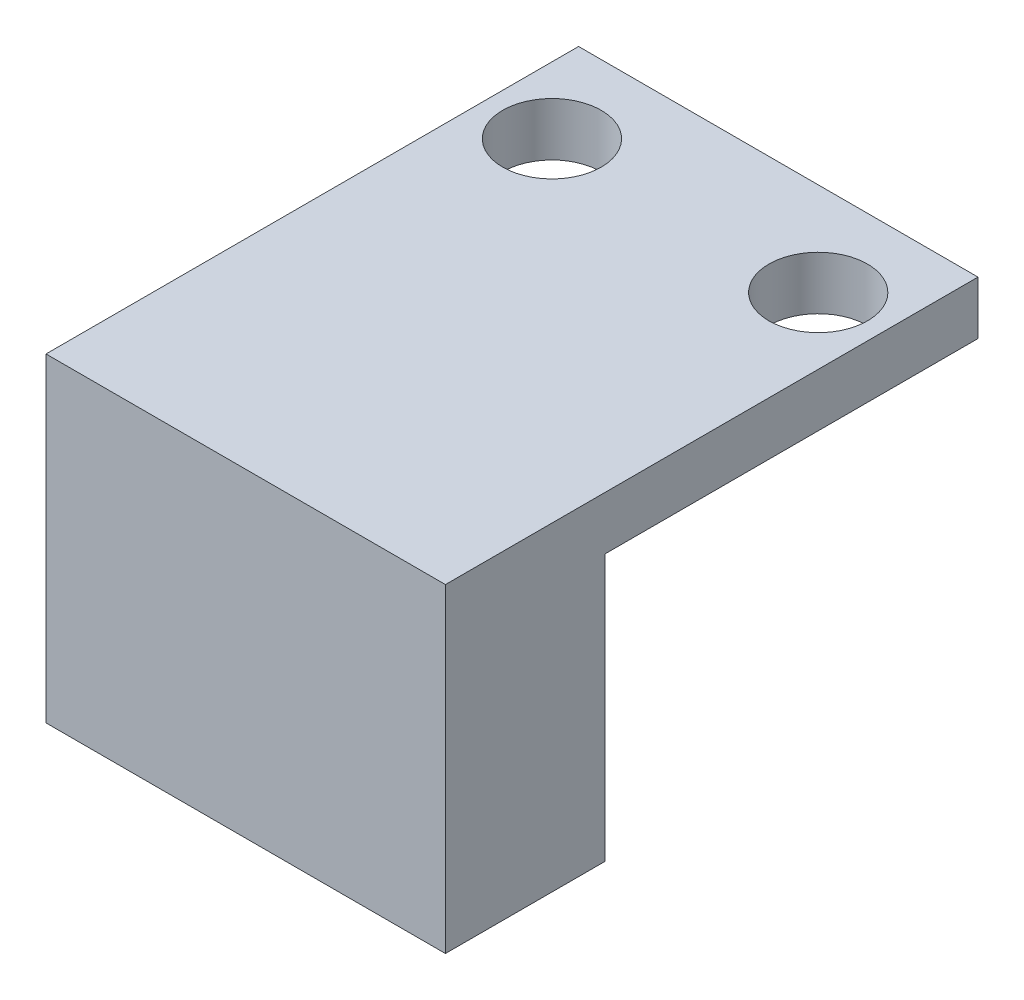
from build123d import *

# Parameters (mm, degrees)
SKETCH1_W           = 15
SKETCH1_H           = 20
SKETCH1_R           = 1.85
BOSS_EXTRUDE1_DEPTH = 2
SKETCH2_W           = 15
SKETCH2_H           = 6
BOSS_EXTRUDE2_DEPTH = 10


with BuildPart() as part:
    # Sketch1 → Boss-Extrude1 (new body)
    with BuildSketch(Plane(origin=(0, 0, 0), x_dir=(1, 0, 0), z_dir=(0, 1, 0))):
        with Locations((0, -6.5)):
            Rectangle(SKETCH1_W, SKETCH1_H)
        with Locations((-5, 0)):
            Circle(SKETCH1_R, mode=Mode.SUBTRACT)
        with Locations((5, 0)):
            Circle(SKETCH1_R, mode=Mode.SUBTRACT)
    extrude(amount=BOSS_EXTRUDE1_DEPTH)

    # Sketch2 → Boss-Extrude2 (add)
    with BuildSketch(Plane.XZ):
        with Locations((0, 13.5)):
            Rectangle(SKETCH2_W, SKETCH2_H)
    extrude(amount=BOSS_EXTRUDE2_DEPTH)


solid = part.part
